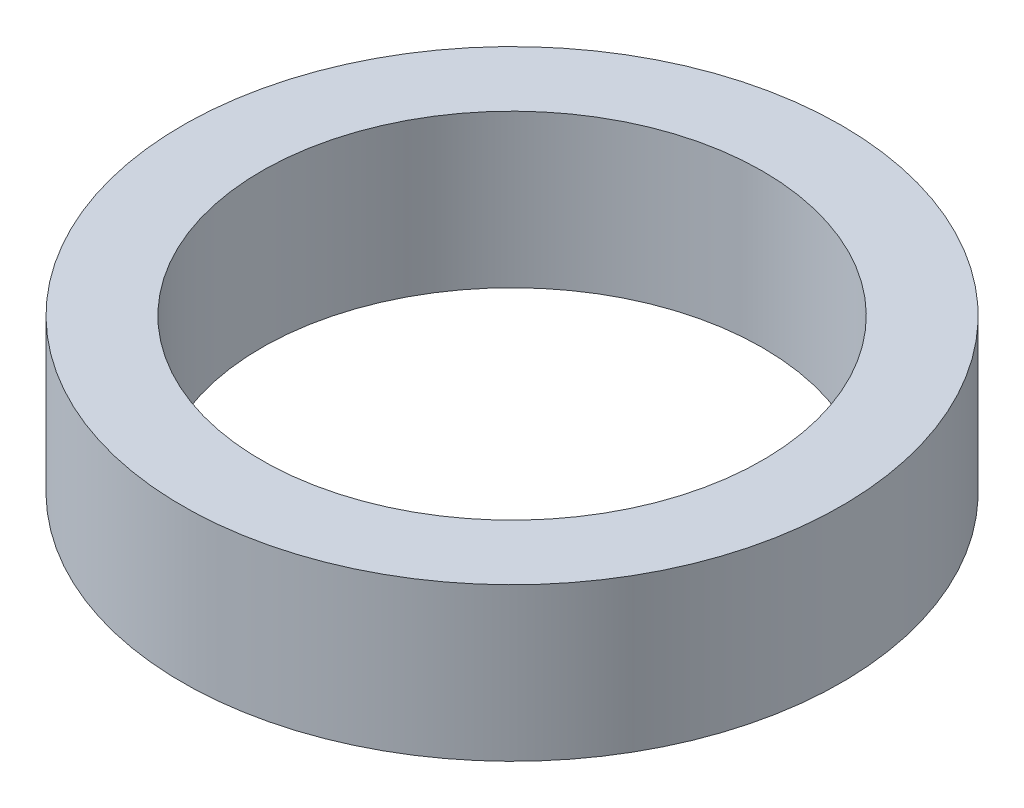
from build123d import *

# Parameters (mm, degrees)
SKETCH1_R           = 62.5
BOSS_EXTRUDE1_DEPTH = 29
SKETCH2_R           = 47.5
CUT_EXTRUDE1_DEPTH  = 94.024190402


with BuildPart() as part:
    # Sketch1 → Boss-Extrude1 (new body)
    with BuildSketch(Plane(origin=(0, 0, 0), x_dir=(1, 0, 0), z_dir=(0, 1, 0))):
        Circle(SKETCH1_R)
    extrude(amount=BOSS_EXTRUDE1_DEPTH)

    # Sketch2 → Cut-Extrude1 (cut, through all)
    with BuildSketch(Plane(origin=(0, 0, 0), x_dir=(1, 0, 0), z_dir=(0, 1, 0))):
        Circle(SKETCH2_R)
    extrude(amount=CUT_EXTRUDE1_DEPTH, mode=Mode.SUBTRACT)


solid = part.part
